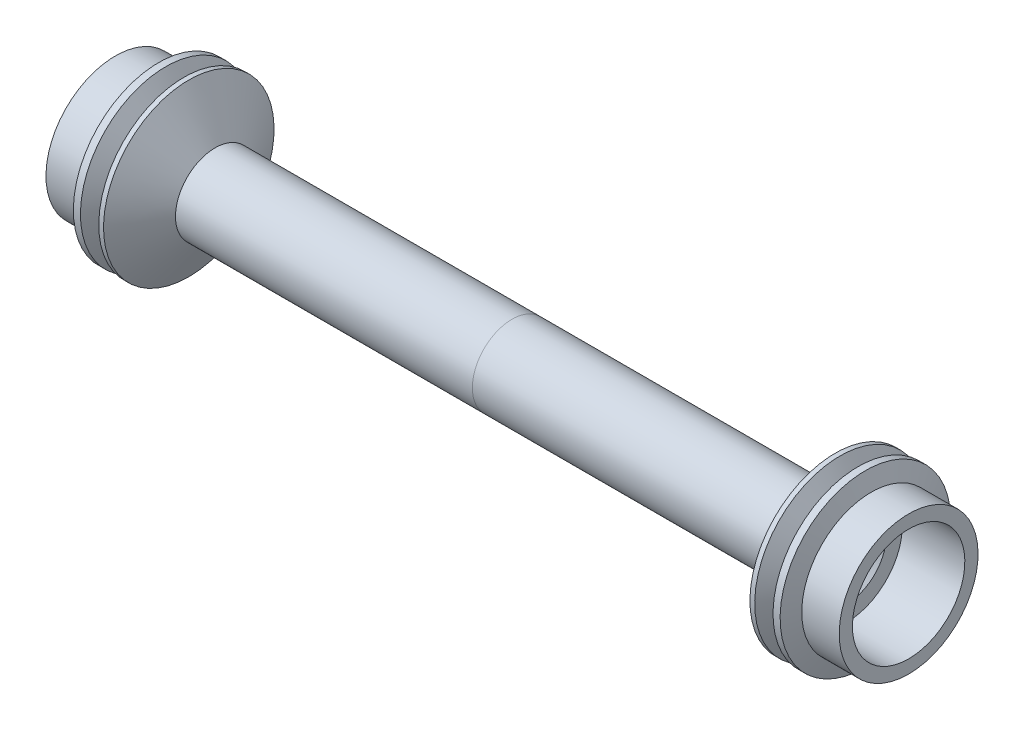
from build123d import *

# Parameters (mm, degrees)
CHAMFER1_SIZE = 0.508


with BuildPart() as part:
    # Sketch2 → Revolve1 (revolve)
    with BuildSketch(Plane.XY):
        Polygon((-28.75, 5.55625), (-31.75, 5.55625), (-31.75, 4.5), (-26.75, 4.5), (-26.75, 3.23), (-26.242, 2.722), (-26.242, 1.7145), (-21.925, 1.7145), (-21.925, 0), (-14.1, 0), (-12.5, 1.6), (0, 1.6), (0, 3.175), (-23.765214988, 3.175), (-25.873265158, 6.82625), (-26.254265158, 6.82625), (-26.9875, 5.55625), (-27.720734842, 6.82625), (-28.287757802, 6.82625), align=None)
    revolve(axis=Axis((-31.75, 0, 0), (1, 0, 0)))


with BuildPart() as body_2:
    # Mirror1: mirrored copy
    add(part.part.mirror(Plane(origin=(0, 0, 0), x_dir=(0, 0, 1), z_dir=(1, 0, 0))))


with BuildPart() as part_1:
    add(part.part)

    # Chamfer1
    chamfer1_edges = [part_1.edges().sort_by_distance(p)[0] for p in [
        (-31.75, -4.5, 0),
    ]]
    chamfer(chamfer1_edges, length=CHAMFER1_SIZE)


solid = Compound([body_2.part, part_1.part])
